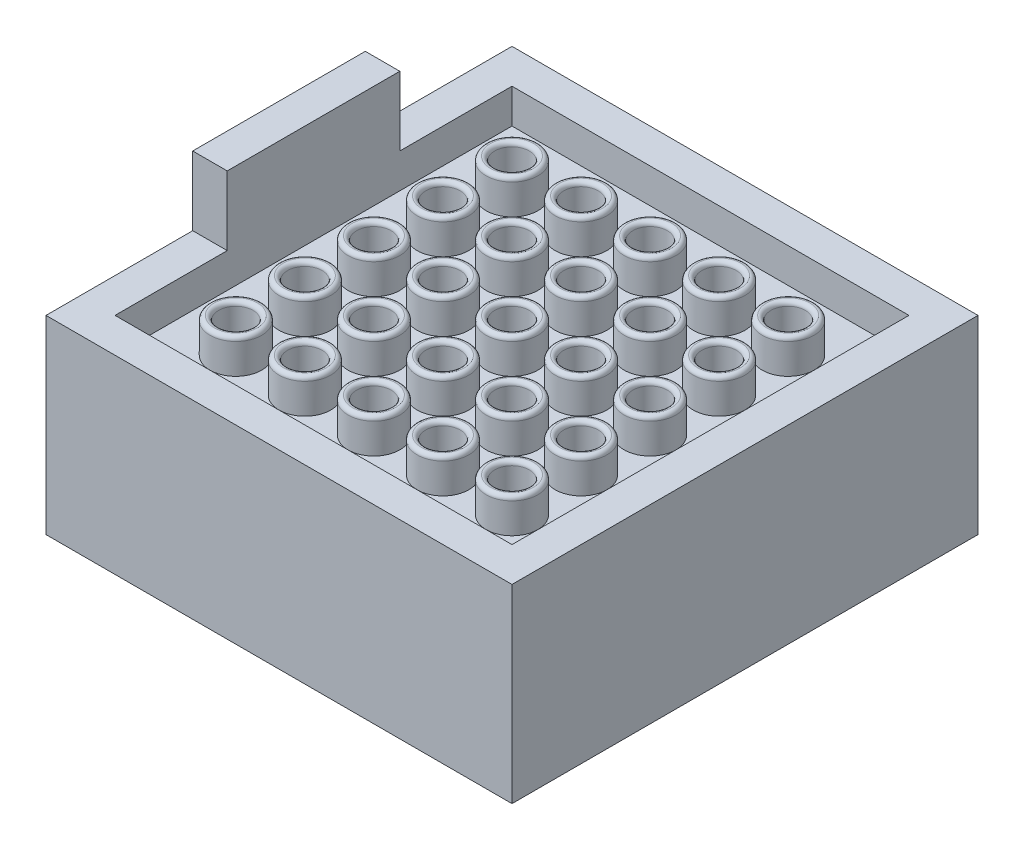
from build123d import *

# Parameters (mm, degrees)
SKETCH1_W              = 27
SKETCH1_H              = 27
SKETCH1_W_2            = 23
SKETCH1_H_2            = 23
BOSS_EXTRUDE1_DEPTH    = 2
SKETCH2_W              = 27
SKETCH2_H              = 27
BOSS_EXTRUDE2_DEPTH    = 2
SKETCH3_W              = 27
SKETCH3_H              = 27
SKETCH3_W_2            = 23
SKETCH3_H_2            = 23
BOSS_EXTRUDE3_DEPTH    = 5
SKETCH6_R              = 1.5
BOSS_EXTRUDE5_DEPTH    = 2
CUT_EXTRUDE2_REACH     = 23.107
SKETCH7_R              = 1
FILLET1_R              = 0.25
LPATTERN3_COUNT        = 5
LPATTERN3_PITCH        = 4
LPATTERN3_COUNT_DIR2   = 5
LPATTERN3_PITCH_DIR2   = 4
FILLET1_OF_LPATTERN3_R = 0.25
SKETCH11_R             = 0.75
BOSS_EXTRUDE8_DEPTH    = 5
LPATTERN2_COUNT        = 6
LPATTERN2_PITCH        = 4
LPATTERN2_COUNT_DIR2   = 6
LPATTERN2_PITCH_DIR2   = 4
SKETCH8_W              = 27
SKETCH8_H              = 27
BOSS_EXTRUDE6_DEPTH    = 2
SKETCH9_R              = 4.25
CUT_EXTRUDE3_DEPTH     = 7
SKETCH10_W             = 2
SKETCH10_H             = 10
BOSS_EXTRUDE7_DEPTH    = 4


with BuildPart() as part:
    # Sketch1 → Boss-Extrude1 (new body)
    with BuildSketch(Plane(origin=(0, 0, 0), x_dir=(1, 0, 0), z_dir=(0, 1, 0))):
        Rectangle(SKETCH1_W, SKETCH1_H)
        Rectangle(SKETCH1_W_2, SKETCH1_H_2, mode=Mode.SUBTRACT)
    extrude(amount=BOSS_EXTRUDE1_DEPTH)

    # Sketch2 → Boss-Extrude2 (add)
    with BuildSketch(Plane.XZ):
        Rectangle(SKETCH2_W, SKETCH2_H)
    extrude(amount=BOSS_EXTRUDE2_DEPTH)

    # Sketch3 → Boss-Extrude3 (add)
    with BuildSketch(Plane.XZ.offset(2)):
        Rectangle(SKETCH3_W, SKETCH3_H)
        Rectangle(SKETCH3_W_2, SKETCH3_H_2, mode=Mode.SUBTRACT)
    extrude(amount=BOSS_EXTRUDE3_DEPTH)

    # Sketch6 → Boss-Extrude5 (add)
    with BuildSketch(Plane(origin=(0, 0, 0), x_dir=(1, 0, 0), z_dir=(0, 1, 0))):
        with Locations(Location((8, 8, 0), (0, 0, 90))):
            Circle(SKETCH6_R)
    boss_extrude5 = extrude(amount=BOSS_EXTRUDE5_DEPTH)

    # Sketch7 → Cut-Extrude2 (cut, up to next)
    with BuildSketch(Plane(origin=(0, 2, 0), x_dir=(1, 0, 0), z_dir=(0, 1, 0)), mode=Mode.PRIVATE) as cut_extrude2_sk1:
        with Locations(Location((8, 8, 0), (0, 0, 270))):
            Circle(SKETCH7_R)
    cut_extrude2_tool1 = extrude(cut_extrude2_sk1.sketch, amount=-CUT_EXTRUDE2_REACH, mode=Mode.PRIVATE) & part.part
    cut_extrude2 = cut_extrude2_tool1.solids().sort_by_distance((8, 2, -8))[0]
    add(cut_extrude2, mode=Mode.SUBTRACT)

    # Fillet1
    fillet1_edges = [part.edges().sort_by_distance(p)[0] for p in [
        (8, 2, -6.5),
        (8, 2, -9),
    ]]
    fillet(fillet1_edges, radius=FILLET1_R - 0.0001)  # a hair under: the kernel refuses the full size

    # LPattern3: Boss-Extrude5, Cut-Extrude2 5 × 5
    with Locations(*[(-j * LPATTERN3_PITCH_DIR2, 0, i * LPATTERN3_PITCH) for i in range(LPATTERN3_COUNT) for j in range(LPATTERN3_COUNT_DIR2) if (i, j) != (0, 0)]):
        add(boss_extrude5)
        add(cut_extrude2, mode=Mode.SUBTRACT)

    # Fillet1 of LPattern3
    fillet1_of_lpattern3_edges = [part.edges().sort_by_distance(p)[0] for p in [
        (4, 2, -6.5),
        (4, 2, -9),
        (0, 2, -6.5),
        (0, 2, -9),
        (-4, 2, -6.5),
        (-4, 2, -9),
        (-8, 2, -6.5),
        (-8, 2, -9),
        (8, 2, -2.5),
        (8, 2, -5),
        (4, 2, -2.5),
        (4, 2, -5),
        (0, 2, -2.5),
        (0, 2, -5),
        (-4, 2, -2.5),
        (-4, 2, -5),
        (-8, 2, -2.5),
        (-8, 2, -5),
        (8, 2, 1.5),
        (8, 2, -1),
        (4, 2, 1.5),
        (4, 2, -1),
        (0, 2, 1.5),
        (0, 2, -1),
        (-4, 2, 1.5),
        (-4, 2, -1),
        (-8, 2, 1.5),
        (-8, 2, -1),
        (8, 2, 5.5),
        (8, 2, 3),
        (4, 2, 5.5),
        (4, 2, 3),
        (0, 2, 5.5),
        (0, 2, 3),
        (-4, 2, 5.5),
        (-4, 2, 3),
        (-8, 2, 5.5),
        (-8, 2, 3),
        (8, 2, 9.5),
        (8, 2, 7),
        (4, 2, 9.5),
        (4, 2, 7),
        (0, 2, 9.5),
        (0, 2, 7),
        (-4, 2, 9.5),
        (-4, 2, 7),
        (-8, 2, 9.5),
        (-8, 2, 7),
    ]]
    fillet(fillet1_of_lpattern3_edges, radius=FILLET1_OF_LPATTERN3_R - 0.0001)  # a hair under: the kernel refuses the full size

    # Sketch11 → Boss-Extrude8 (add)
    with BuildSketch(Plane.XZ.offset(2)):
        with Locations(Location((-9.9, 9.9, 0), (0, 0, 90))):
            Circle(SKETCH11_R)
    boss_extrude8 = extrude(amount=BOSS_EXTRUDE8_DEPTH)

    # LPattern2: Boss-Extrude8 6 × 6
    with Locations(*[(i * LPATTERN2_PITCH, 0, -j * LPATTERN2_PITCH_DIR2) for i in range(LPATTERN2_COUNT) for j in range(LPATTERN2_COUNT_DIR2) if (i, j) != (0, 0)]):
        add(boss_extrude8)

    # Sketch8 → Boss-Extrude6 (add)
    with BuildSketch(Plane.XZ.offset(7)):
        Rectangle(SKETCH8_W, SKETCH8_H)
    extrude(amount=BOSS_EXTRUDE6_DEPTH)

    # Sketch9 → Cut-Extrude3 (cut)
    with BuildSketch(Plane.XZ.offset(9)):
        with Locations(Location((0, 0, 0), (0, 0, 270))):
            Circle(SKETCH9_R)
    extrude(amount=-CUT_EXTRUDE3_DEPTH, mode=Mode.SUBTRACT)

    # Sketch10 → Boss-Extrude7 (add)
    with BuildSketch(Plane(origin=(0, 2, 0), x_dir=(1, 0, 0), z_dir=(0, 1, 0))):
        with Locations((-12.5, 0)):
            Rectangle(SKETCH10_W, SKETCH10_H)
    extrude(amount=BOSS_EXTRUDE7_DEPTH)


solid = part.part
